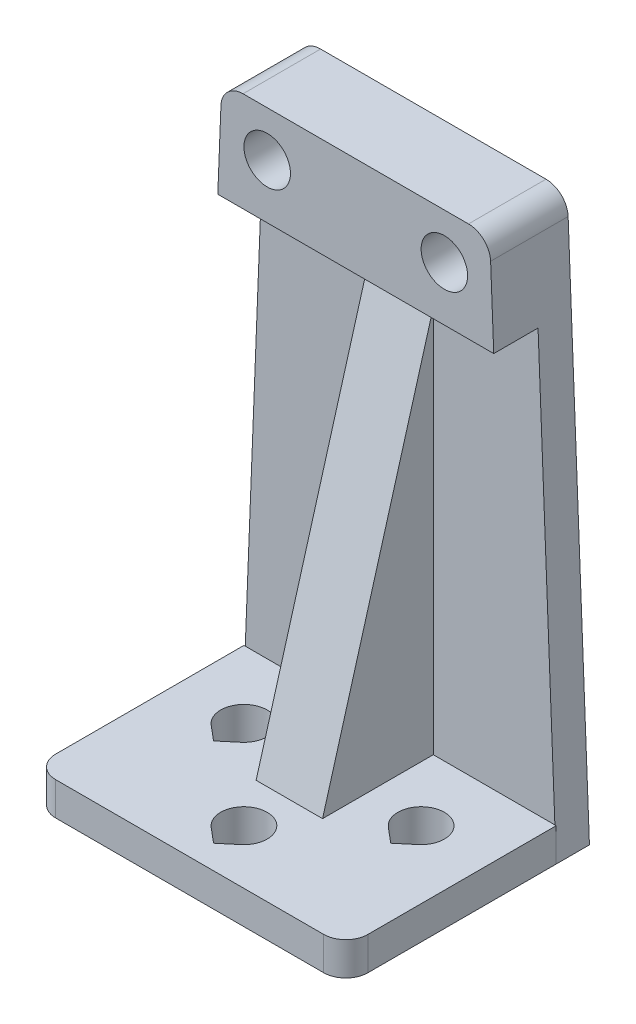
from build123d import *

# Parameters (mm, degrees)
SKETCH1_W           = 28.2
SKETCH1_H           = 19
BOSS_EXTRUDE1_DEPTH = 3
SKETCH2_R           = 2.1
BOSS_EXTRUDE2_DEPTH = 3
BOSS_EXTRUDE3_DEPTH = 3
FILLET1_R           = 2
SKETCH4_R           = 2.1
BOSS_EXTRUDE4_DEPTH = 4


with BuildPart() as part:
    # Sketch1 → Boss-Extrude1 (new body)
    with BuildSketch(Plane(origin=(0, 0, 0), x_dir=(1, 0, 0), z_dir=(0, 1, 0))):
        with Locations((0, -9.5)):
            Rectangle(SKETCH1_W, SKETCH1_H)
        with BuildLine():
            Line((-9.34985398, -7.708693331), (-8, -8.841355308))
            Line((-8, -8.841355308), (-6.65014602, -7.708693331))
            ThreePointArc((-6.65014602, -7.708693331), (-8, -4), (-9.34985398, -7.708693331))
        make_face(mode=Mode.SUBTRACT)
        with BuildLine():
            Line((-1.34985398, -15.708693331), (0, -16.841355308))
            Line((0, -16.841355308), (1.34985398, -15.708693331))
            ThreePointArc((1.34985398, -15.708693331), (0, -12), (-1.34985398, -15.708693331))
        make_face(mode=Mode.SUBTRACT)
        with BuildLine():
            Line((6.65014602, -7.708693331), (8, -8.841355308))
            Line((8, -8.841355308), (9.34985398, -7.708693331))
            ThreePointArc((9.34985398, -7.708693331), (8, -4), (6.65014602, -7.708693331))
        make_face(mode=Mode.SUBTRACT)
    extrude(amount=BOSS_EXTRUDE1_DEPTH)

    # Sketch2 → Boss-Extrude2 (add)
    with BuildSketch(Plane(origin=(0, 0, 0), x_dir=(-1, 0, 0), z_dir=(0, 0, -1))):
        Polygon((-14.1, 0), (14.1, 0), (12.1, 50.1), (-12.1, 50.1), align=None)
        with Locations((-8, 46)):
            Circle(SKETCH2_R, mode=Mode.SUBTRACT)
        with Locations((8, 46)):
            Circle(SKETCH2_R, mode=Mode.SUBTRACT)
    extrude(amount=BOSS_EXTRUDE2_DEPTH)

    # Sketch3 → Boss-Extrude3 (add, symmetric)
    with BuildSketch(Plane(origin=(0, 0, 0), x_dir=(0, 0, -1), z_dir=(1, 0, 0))):
        Polygon((0, 3), (-10, 3), (0, 38), align=None)
    extrude(amount=BOSS_EXTRUDE3_DEPTH, both=True)

    # Fillet1
    fillet1_edges = [part.edges().sort_by_distance(p)[0] for p in [
        (12.1, 50.1, -1.5),
        (-12.1, 50.1, -1.5),
        (14.1, 1.5, 19),
        (-14.1, 1.5, 19),
    ]]
    fillet(fillet1_edges, radius=FILLET1_R)

    # Sketch4 → Boss-Extrude4 (add)
    with BuildSketch(Plane.XY):
        with BuildLine():
            Line((-10.178247335, 50.1), (10.178247335, 50.1))
            ThreePointArc((10.178247335, 50.1), (11.563968527, 49.54214312), (12.176655618, 48.179776778))
            Line((12.176655618, 48.179776778), (12.459281437, 41.1))
            Line((12.459281437, 41.1), (-12.459281437, 41.1))
            Line((-12.459281437, 41.1), (-12.176655618, 48.179776778))
            ThreePointArc((-12.176655618, 48.179776778), (-11.563968527, 49.54214312), (-10.178247335, 50.1))
        make_face()
        with Locations((-8, 46)):
            Circle(SKETCH4_R, mode=Mode.SUBTRACT)
        with Locations((8, 46)):
            Circle(SKETCH4_R, mode=Mode.SUBTRACT)
    extrude(amount=BOSS_EXTRUDE4_DEPTH)


solid = part.part
